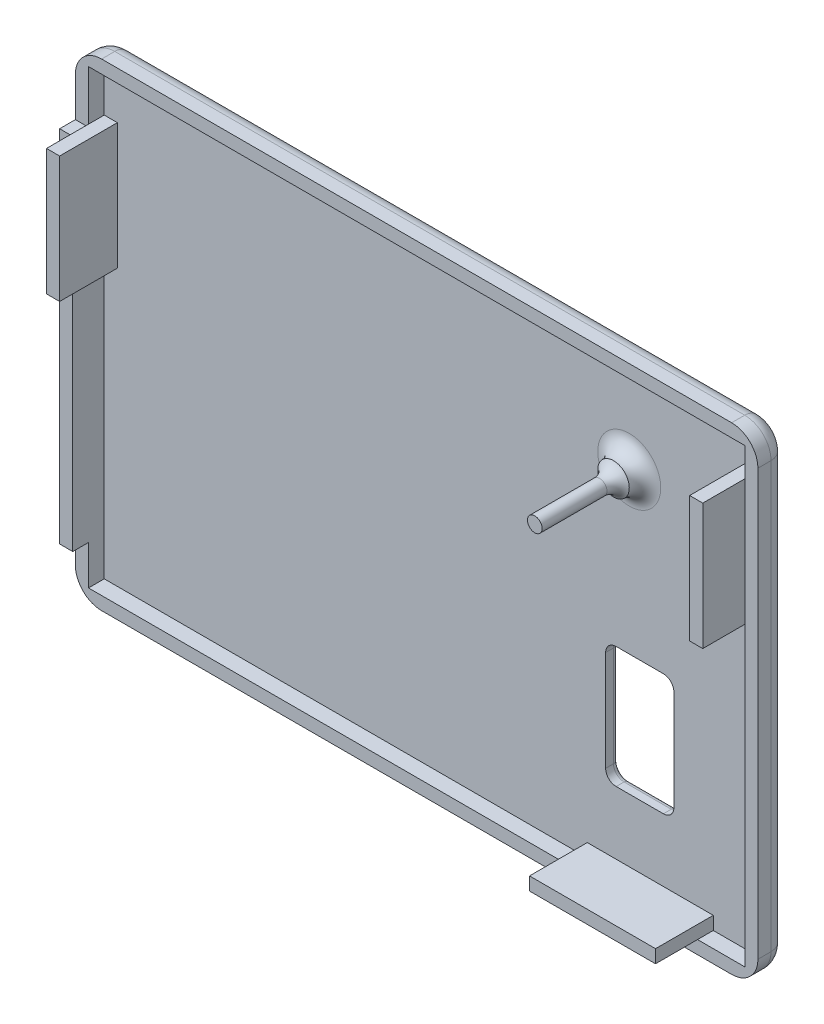
from build123d import *

# Parameters (mm, degrees)
SKETCH1_W            = 130
SKETCH1_H            = 91
BOSS_EXTRUDE1_DEPTH  = 2.5
SKETCH3_W            = 130
SKETCH3_H            = 2.5
BOSS_EXTRUDE2_DEPTH  = 3
SKETCH2_W            = 130
SKETCH2_H            = 2.5
BOSS_EXTRUDE3_DEPTH  = 3
SKETCH4_W            = 2.5
SKETCH4_H            = 86
BOSS_EXTRUDE4_DEPTH  = 3
SKETCH5_W            = 2.5
SKETCH5_H            = 86
BOSS_EXTRUDE5_DEPTH  = 3
FILLET2_R            = 5
FILLET3_R            = 5
FILLET4_R            = 5
FILLET5_R            = 5
SKETCH7_W            = 2.5
SKETCH7_H            = 68.5
BOSS_EXTRUDE6_DEPTH  = 3
SKETCH8_W            = 24
SKETCH8_H            = 2.5
BOSS_EXTRUDE7_DEPTH  = 11
SKETCH9_W            = 2.5
SKETCH9_H            = 24
BOSS_EXTRUDE8_DEPTH  = 11
SKETCH10_W           = 2.5
SKETCH10_H           = 24
BOSS_EXTRUDE9_DEPTH  = 11
SKETCH11_R           = 3
BOSS_EXTRUDE10_DEPTH = 3
SKETCH12_R           = 1.4
BOSS_EXTRUDE11_DEPTH = 15
SKETCH13_W           = 13
SKETCH13_H           = 23.1
CUT_EXTRUDE1_DEPTH   = 160.702849067
FILLET17_R           = 2
FILLET18_R           = 2
FILLET19_R           = 2
FILLET20_R           = 2
FILLET23_R           = 1
FILLET24_R           = 3
FILLET25_R           = 3
FILLET26_R           = 3


# Some blends are built 0.0001 mm under size
with BuildPart() as part:
    # Sketch1 → Boss-Extrude1 (new body)
    with BuildSketch(Plane.XY):
        with Locations((65, -45.5)):
            Rectangle(SKETCH1_W, SKETCH1_H)
    extrude(amount=BOSS_EXTRUDE1_DEPTH)

    # Sketch3 → Boss-Extrude2 (add)
    with BuildSketch(Plane.XY.offset(2.5)):
        with Locations((65, -89.75)):
            Rectangle(SKETCH3_W, SKETCH3_H)
    extrude(amount=BOSS_EXTRUDE2_DEPTH)

    # Sketch2 → Boss-Extrude3 (add)
    with BuildSketch(Plane.XY.offset(2.5)):
        with Locations((65, -1.25)):
            Rectangle(SKETCH2_W, SKETCH2_H)
    extrude(amount=BOSS_EXTRUDE3_DEPTH)

    # Sketch4 → Boss-Extrude4 (add)
    with BuildSketch(Plane.XY.offset(2.5)):
        with Locations((128.75, -45.5)):
            Rectangle(SKETCH4_W, SKETCH4_H)
    extrude(amount=BOSS_EXTRUDE4_DEPTH)

    # Sketch5 → Boss-Extrude5 (add)
    with BuildSketch(Plane.XY.offset(2.5)):
        with Locations((1.25, -45.5)):
            Rectangle(SKETCH5_W, SKETCH5_H)
    extrude(amount=BOSS_EXTRUDE5_DEPTH)

    # Fillet2
    fillet2_edges = [part.edges().sort_by_distance(p)[0] for p in [
        (130, -91, 2.75),
    ]]
    fillet(fillet2_edges, radius=FILLET2_R)

    # Fillet3
    fillet3_edges = [part.edges().sort_by_distance(p)[0] for p in [
        (130, 0, 2.75),
    ]]
    fillet(fillet3_edges, radius=FILLET3_R)

    # Fillet4
    fillet4_edges = [part.edges().sort_by_distance(p)[0] for p in [
        (0, 0, 2.75),
    ]]
    fillet(fillet4_edges, radius=FILLET4_R)

    # Fillet5
    fillet5_edges = [part.edges().sort_by_distance(p)[0] for p in [
        (0, -91, 2.75),
    ]]
    fillet(fillet5_edges, radius=FILLET5_R)

    # Sketch7 → Boss-Extrude6 (add)
    with BuildSketch(Plane.XY.offset(5.5)):
        with Locations((1.25, -46.75)):
            Rectangle(SKETCH7_W, SKETCH7_H)
    extrude(amount=BOSS_EXTRUDE6_DEPTH)

    # Sketch8 → Boss-Extrude7 (add)
    with BuildSketch(Plane.XY.offset(2.5)):
        with Locations((106.5, -87.25)):
            Rectangle(SKETCH8_W, SKETCH8_H)
    extrude(amount=BOSS_EXTRUDE7_DEPTH)

    # Sketch9 → Boss-Extrude8 (add)
    with BuildSketch(Plane.XY.offset(2.5)):
        with Locations((126.25, -20)):
            Rectangle(SKETCH9_W, SKETCH9_H)
    extrude(amount=BOSS_EXTRUDE8_DEPTH)

    # Sketch10 → Boss-Extrude9 (add)
    with BuildSketch(Plane.XY.offset(2.5)):
        with Locations((3.75, -24)):
            Rectangle(SKETCH10_W, SKETCH10_H)
    extrude(amount=BOSS_EXTRUDE9_DEPTH)

    # Sketch11 → Boss-Extrude10 (add)
    with BuildSketch(Plane.XY.offset(2.5)):
        with Locations(Location((102.5, -20.5, 0), (0, 0, 180))):
            Circle(SKETCH11_R)
    extrude(amount=BOSS_EXTRUDE10_DEPTH)

    # Sketch12 → Boss-Extrude11 (add)
    with BuildSketch(Plane.XY.offset(5.5)):
        with Locations((102.5, -20.5)):
            Circle(SKETCH12_R)
    extrude(amount=BOSS_EXTRUDE11_DEPTH)

    # Sketch13 → Cut-Extrude1 (cut, through all)
    with BuildSketch(Plane.XY.offset(2.5)):
        with Locations((104.5, -62.45)):
            Rectangle(SKETCH13_W, SKETCH13_H)
    extrude(amount=-CUT_EXTRUDE1_DEPTH, mode=Mode.SUBTRACT)

    # Fillet17
    fillet17_edges = [part.edges().sort_by_distance(p)[0] for p in [
        (98, -74, 1.25),
    ]]
    fillet(fillet17_edges, radius=FILLET17_R)

    # Fillet18
    fillet18_edges = [part.edges().sort_by_distance(p)[0] for p in [
        (98, -50.9, 1.25),
    ]]
    fillet(fillet18_edges, radius=FILLET18_R)

    # Fillet19
    fillet19_edges = [part.edges().sort_by_distance(p)[0] for p in [
        (111, -50.9, 1.25),
    ]]
    fillet(fillet19_edges, radius=FILLET19_R)

    # Fillet20
    fillet20_edges = [part.edges().sort_by_distance(p)[0] for p in [
        (111, -74, 1.25),
    ]]
    fillet(fillet20_edges, radius=FILLET20_R)

    # Fillet23
    fillet23_edges = [part.edges().sort_by_distance(p)[0] for p in [
        (104.5, -74, 0),
        (98.585786438, -73.414213562, 0),
        (98, -62.45, 0),
        (98.585786438, -51.485786438, 0),
        (104.5, -50.9, 0),
        (110.414213562, -51.485786438, 0),
        (111, -62.45, 0),
        (110.414213562, -73.414213562, 0),
    ]]
    fillet(fillet23_edges, radius=FILLET23_R)

    # Fillet24
    fillet24_edges = [part.edges().sort_by_distance(p)[0] for p in [
        (128.535533906, -89.535533906, 0),
        (130, -45.5, 0),
        (128.535533906, -1.464466094, 0),
        (0, -45.5, 0),
        (65, 0, 0),
        (1.464466094, -1.464466094, 0),
        (65, -91, 0),
        (1.464466094, -89.535533906, 0),
    ]]
    fillet(fillet24_edges, radius=FILLET24_R)

    # Fillet25
    # the kernel refuses this fillet: 3 mm, written as the material it adds along each edge
    with BuildSketch(Plane(origin=(102.5, -20.5, 5.5), x_dir=(1, 0, 0), z_dir=(0, -1, 0))) as fillet25_piece_1:
        with BuildLine():
            CenterArc((4.4, 2.653299832), FILLET25_R, 180, 62.181860715)
            Line((1.4, 2.653299832), (1.34, 2.653299832))
            Line((1.34, 2.653299832), (1.34, 0))
            Line((1.34, 0), (1.4, -0.06))
            ThreePointArc((1.4, -0.06), (2.2, -0.06), (2.972, -0.053065997))
            Line((2.972, -0.053065997), (3, 0))
        make_face()
    revolve(axis=Axis((102.5, -20.5, 5.5), (0, 0, 1)))

    # Fillet26
    fillet26_edges = [part.edges().sort_by_distance(p)[0] for p in [
        (105.5, -20.5, 2.5),
    ]]
    fillet(fillet26_edges, radius=FILLET26_R - 0.0001)  # a hair under: the kernel refuses the full size


solid = part.part
